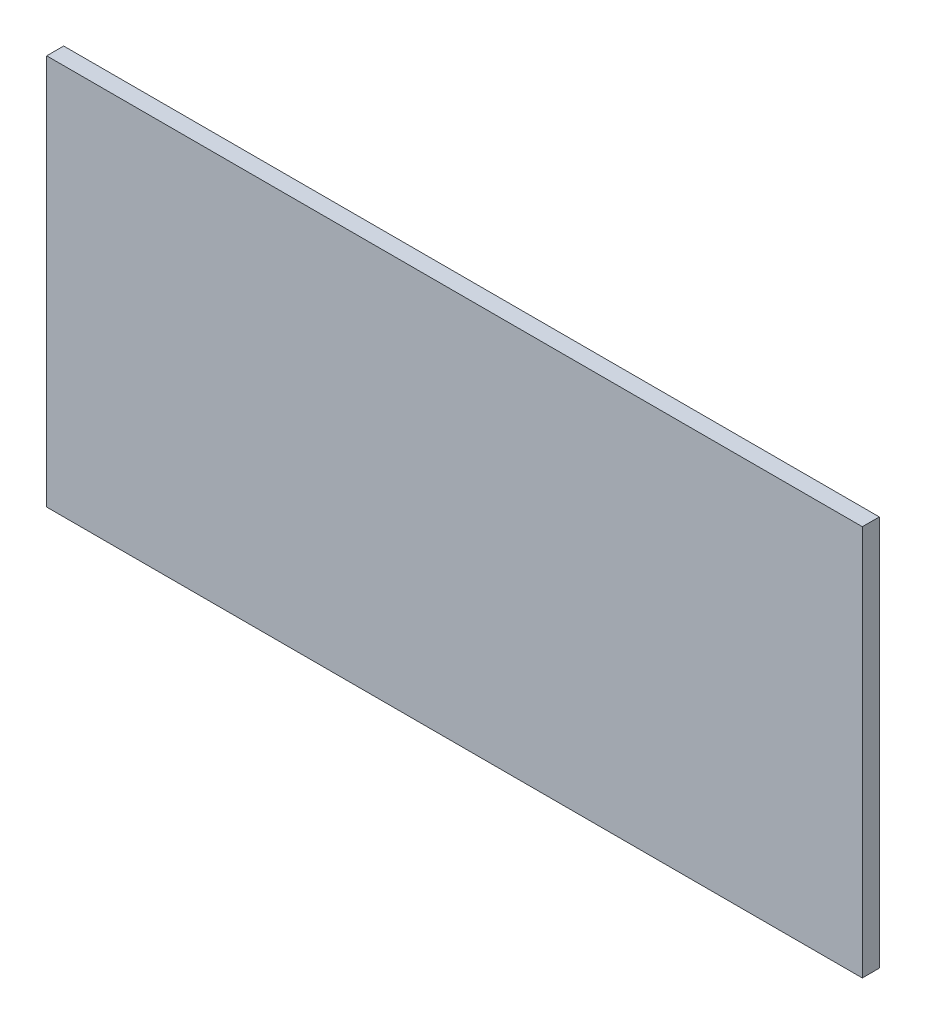
from build123d import *

# Parameters (mm, degrees)
SKETCH1_W           = 96
SKETCH1_H           = 46
BOSS_EXTRUDE1_DEPTH = 2


with BuildPart() as part:
    # Sketch1 → Boss-Extrude1 (new body)
    with BuildSketch(Plane.XY):
        with Locations((48, 23)):
            Rectangle(SKETCH1_W, SKETCH1_H)
    extrude(amount=BOSS_EXTRUDE1_DEPTH)


solid = part.part
